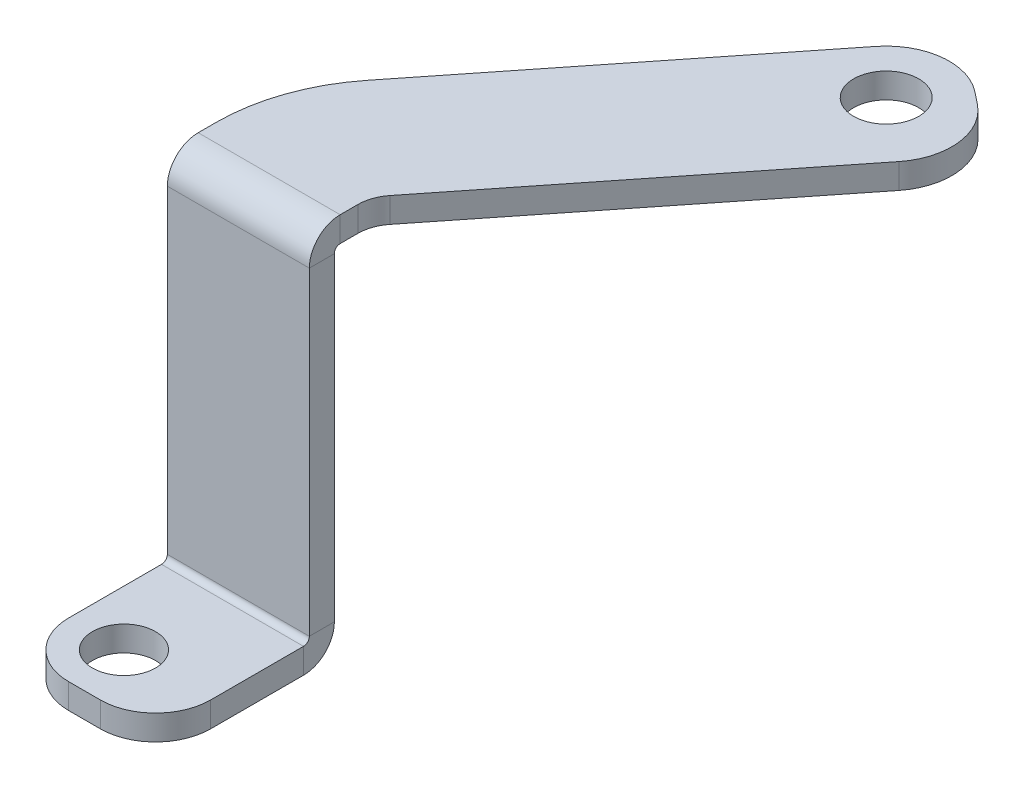
from build123d import *

# Parameters (mm, degrees)
SKETCH1_R                    = 4
BASE_FLANGE1_DEPTH           = 3.175
EDGE_FLANGE1_STRIP_W         = 14.1732
EDGE_FLANGE1_STRIP_H         = 3.175
EDGE_FLANGE1_STRIP_CUT_DEPTH = 18
EDGE_FLANGE1_DEPTH           = 18
EDGE_FLANGE2_STRIP_W         = 14.1732
EDGE_FLANGE2_STRIP_H         = 3.175
EDGE_FLANGE2_STRIP_CUT_DEPTH = 18
EDGE_FLANGE2_DEPTH           = 18
SKETCH12_R                   = 4.125
BOSS_EXTRUDE1_DEPTH          = 3.175


# Sheet-metal steps are written as plain solids
with BuildPart() as part:
    # Sketch1 → Base-Flange1 (new body)
    with BuildSketch(Plane(origin=(0, 0, 0), x_dir=(1, 0, 0), z_dir=(0, 1, 0))):
        with BuildLine():
            Line((-7, 12.5), (-7, 0))
            ThreePointArc((-7, 0), (-4.949747468, -4.949747468), (0, -7))
            Line((0, -7), (4, -7))
            ThreePointArc((4, -7), (8.949747468, -4.949747468), (11, 0))
            Line((11, 0), (11, 12.5))
            Line((11, 12.5), (-7, 12.5))
        make_face()
        with Locations(Location((0, 0, 0), (0, 0, 270))):
            Circle(SKETCH1_R, mode=Mode.SUBTRACT)
    extrude(amount=-BASE_FLANGE1_DEPTH)

    # Edge-Flange1 strip (across the edge) → Edge-Flange1 strip cut (cut)
    with BuildSketch(Plane(origin=(11, 0, -12.5), x_dir=(0, 0, 1), z_dir=(-1, 0, 0))):
        with Locations((-6.35, -1.5875)):
            Rectangle(EDGE_FLANGE1_STRIP_W, EDGE_FLANGE1_STRIP_H)
    extrude(amount=EDGE_FLANGE1_STRIP_CUT_DEPTH, mode=Mode.SUBTRACT)

    # Edge-Flange1 section (across the edge) → Edge-Flange1 (add)
    with BuildSketch(Plane(origin=(11, 0, -12.5), x_dir=(0, 0, 1), z_dir=(-1, 0, 0))):
        with BuildLine():
            Line((-3.175, 0.7366), (-3.175, 41.8875))
            Line((-3.175, 41.8875), (0, 41.8875))
            Line((0, 41.8875), (0, 0.7366))
            ThreePointArc((0, 0.7366), (0.215745145, 0.215745145), (0.7366, 0))
            Line((0.7366, 0), (0.7366, -3.175))
            ThreePointArc((0.7366, -3.175), (-2.029318885, -2.029318885), (-3.175, 0.7366))
        make_face()
    extrude(amount=EDGE_FLANGE1_DEPTH)

    # Edge-Flange2 strip (across the edge) → Edge-Flange2 strip cut (cut)
    with BuildSketch(Plane(origin=(-7, 41.8875, -15.675), x_dir=(0, -1, 0), z_dir=(1, 0, 0))):
        with Locations((-6.35, -1.5875)):
            Rectangle(EDGE_FLANGE2_STRIP_W, EDGE_FLANGE2_STRIP_H)
    extrude(amount=EDGE_FLANGE2_STRIP_CUT_DEPTH, mode=Mode.SUBTRACT)

    # Edge-Flange2 section (across the edge) → Edge-Flange2 (add)
    with BuildSketch(Plane(origin=(-7, 41.8875, -15.675), x_dir=(0, -1, 0), z_dir=(1, 0, 0))):
        with BuildLine():
            Line((-3.175, 0.7366), (-3.175, 3))
            Line((-3.175, 3), (0, 3))
            Line((0, 3), (0, 0.7366))
            ThreePointArc((0, 0.7366), (0.215745145, 0.215745145), (0.7366, 0))
            Line((0.7366, 0), (0.7366, -3.175))
            ThreePointArc((0.7366, -3.175), (-2.029318885, -2.029318885), (-3.175, 0.7366))
        make_face()
    extrude(amount=EDGE_FLANGE2_DEPTH)

    # Sketch12 → Boss-Extrude1 (add)
    with BuildSketch(Plane(origin=(0, 45.0625, 0), x_dir=(1, 0, 0), z_dir=(0, 1, 0))):
        with BuildLine():
            Line((11, 18.675), (-7, 18.675))
            ThreePointArc((-7, 18.675), (-5.730267968, 26.179894377), (-2.062407049, 32.849411251))
            Line((-2.062407049, 32.849411251), (26.4814048, 68.848399382))
            ThreePointArc((26.4814048, 68.848399382), (31.832032475, 71.825161968), (37.720386598, 70.146585866))
            Line((37.720386598, 70.146585866), (39.287532633, 68.903986451))
            ThreePointArc((39.287532633, 68.903986451), (42.264295219, 63.553358776), (40.585719117, 57.665004653))
            Line((40.585719117, 57.665004653), (12.041907268, 21.666016522))
            ThreePointArc((12.041907268, 21.666016522), (11.267932785, 20.258646945), (11, 18.675))
        make_face()
        with Locations(Location((32.749988941, 63.878001725, 0), (0, 0, 270))):
            Circle(SKETCH12_R, mode=Mode.SUBTRACT)
    extrude(amount=-BOSS_EXTRUDE1_DEPTH)


solid = part.part
